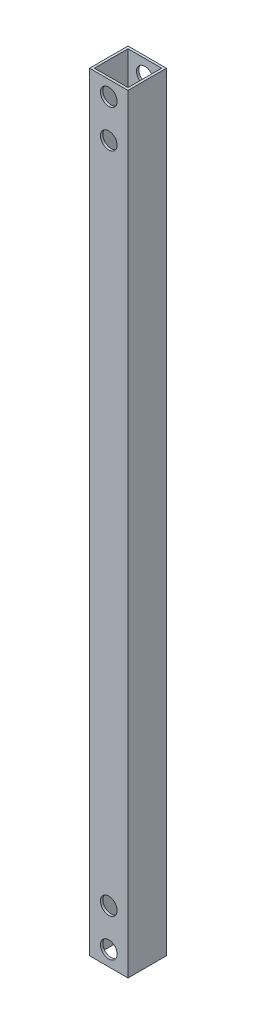
from build123d import *

# Parameters (mm, degrees)
SKETCH1_W                       = 25.4
SKETCH1_H                       = 25.4
SKETCH1_W_2                     = 22.225
SKETCH1_H_2                     = 22.225
EXTRUDE_THIN1_DEPTH             = 508
M10_CLEARANCE_HOLE1_D           = 11
M10_CLEARANCE_HOLE1_CSINK_D     = 11.05
M10_CLEARANCE_HOLE1_CSINK_ANGLE = 90


with BuildPart() as part:
    # Sketch1 → Extrude-Thin1 (new body)
    with BuildSketch(Plane(origin=(0, 0, 0), x_dir=(1, 0, 0), z_dir=(0, 1, 0))):
        Rectangle(SKETCH1_W, SKETCH1_H)
        Rectangle(SKETCH1_W_2, SKETCH1_H_2, mode=Mode.SUBTRACT)
    extrude(amount=EXTRUDE_THIN1_DEPTH)

    # M10 Clearance Hole1 (through all)
    with Locations(Plane(origin=(0, 0, -12.7), x_dir=(-1, 0, 0), z_dir=(0, 0, -1))):
        with Locations((0, 498), (0, 473), (0, 35), (0, 10)):
            CounterSinkHole(M10_CLEARANCE_HOLE1_D / 2, M10_CLEARANCE_HOLE1_CSINK_D / 2, counter_sink_angle=M10_CLEARANCE_HOLE1_CSINK_ANGLE)


solid = part.part
